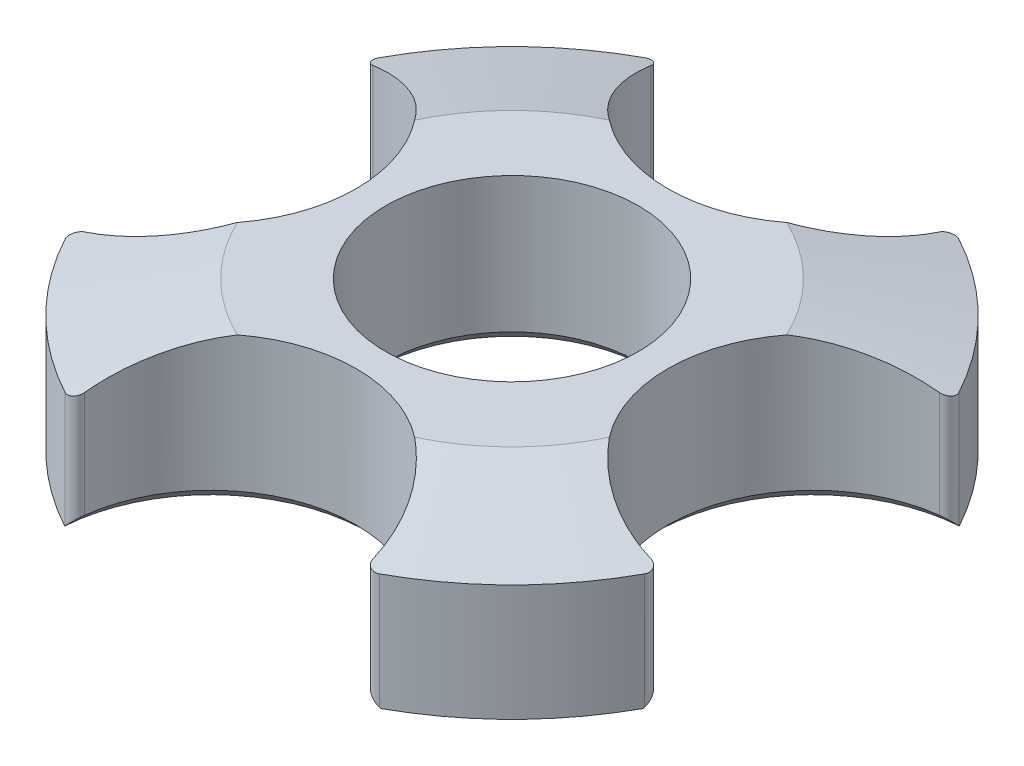
from build123d import *

# Parameters (mm, degrees)
SKETCH6_R          = 8.395538939
CUT_EXTRUDE2_DEPTH = 37.932718002
CIRPATTERN1_COUNT  = 4
SKETCH7_R          = 7.3025
CUT_EXTRUDE3_DEPTH = 37.677063494
CHAMFER1_SIZE      = 0.762
SKETCH8_R          = 38.1
SKETCH8_R_2        = 19.05
CUT_EXTRUDE4_DEPTH = 37.67706347
FILLET1_R          = 0.508


with BuildPart() as part:
    # Sketch5 → Revolve1 (revolve)
    with BuildSketch(Plane.XY):
        Polygon((0, 0), (-25.4, 0), (-25.4, 5.08), (-11.90625, 8.5852), (0, 8.5852), align=None)
    revolve(axis=Axis((0, 8.5852, 0), (0, -1, 0)))

    # Sketch6 → Cut-Extrude2 (cut, through all)
    with BuildSketch(Plane.XZ):
        with Locations((0, 17.399)):
            Circle(SKETCH6_R)
    cut_extrude2 = extrude(amount=-CUT_EXTRUDE2_DEPTH, mode=Mode.SUBTRACT)

    # CirPattern1: Cut-Extrude2 ×4 about axis
    cirpattern1_axis = Axis((0, 0, 0), (0, 1, 0))
    for i in range(1, CIRPATTERN1_COUNT):
        add(cut_extrude2.rotate(cirpattern1_axis, i * 360 / CIRPATTERN1_COUNT), mode=Mode.SUBTRACT)

    # Sketch7 → Cut-Extrude3 (cut, through all)
    with BuildSketch(Plane.XZ):
        Circle(SKETCH7_R)
    extrude(amount=-CUT_EXTRUDE3_DEPTH, mode=Mode.SUBTRACT)

    # Chamfer1
    chamfer1_edges = [part.edges().sort_by_distance(p)[0] for p in [
        (17.960512242, 0, -17.960512242),
        (0, 0, -9.003461061),
        (-17.960512242, 0, -17.960512242),
        (-9.003461061, 0, 0),
        (-17.960512242, 0, 17.960512242),
        (0, 0, 9.003461061),
        (17.960512242, 0, 17.960512242),
        (9.003461061, 0, 0),
        (-7.3025, 0, 0),
    ]]
    chamfer(chamfer1_edges, length=CHAMFER1_SIZE)

    # Sketch8 → Cut-Extrude4 (cut, through all)
    with BuildSketch(Plane(origin=(0, 8.5852, 0), x_dir=(1, 0, 0), z_dir=(0, 1, 0))):
        Circle(SKETCH8_R)
        Circle(SKETCH8_R_2, mode=Mode.SUBTRACT)
    extrude(amount=-CUT_EXTRUDE4_DEPTH, mode=Mode.SUBTRACT)

    # Fillet1
    fillet1_edges = [part.edges().sort_by_distance(p)[0] for p in [
        (17.102782543, 3.745752941, -8.390311633),
        (17.102782543, 3.745752944, 8.390311633),
        (-8.390311633, 3.745752941, -17.102782543),
        (8.390311633, 3.745752944, -17.102782543),
        (-17.102782543, 3.745752941, 8.390311633),
        (-17.102782543, 3.745752944, -8.390311633),
        (-8.390311633, 3.745752944, 17.102782543),
        (8.390311633, 3.745752941, 17.102782543),
    ]]
    fillet(fillet1_edges, radius=FILLET1_R)


solid = part.part
